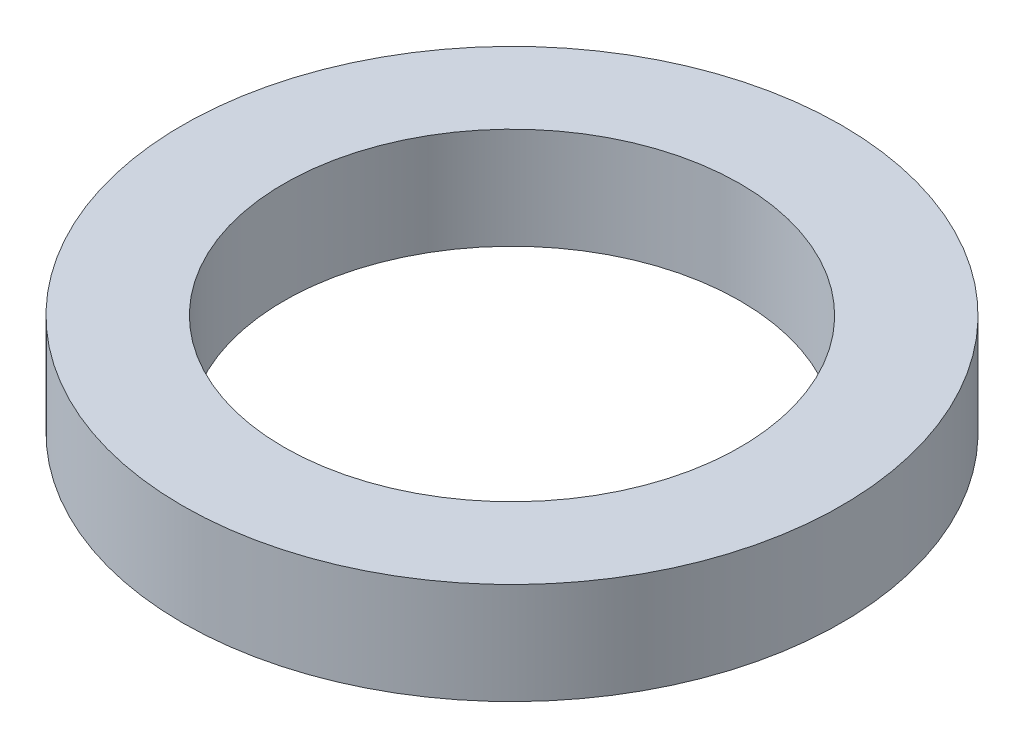
from build123d import *

# Parameters (mm, degrees)
SKETCH1_R           = 32.5
BOSS_EXTRUDE1_DEPTH = 10
SKETCH2_R           = 22.5
CUT_EXTRUDE1_DEPTH  = 48.037219306


with BuildPart() as part:
    # Sketch1 → Boss-Extrude1 (new body)
    with BuildSketch(Plane(origin=(0, 0, 0), x_dir=(1, 0, 0), z_dir=(0, 1, 0))):
        Circle(SKETCH1_R)
    extrude(amount=BOSS_EXTRUDE1_DEPTH)

    # Sketch2 → Cut-Extrude1 (cut, through all)
    with BuildSketch(Plane(origin=(0, 0, 0), x_dir=(1, 0, 0), z_dir=(0, 1, 0))):
        Circle(SKETCH2_R)
    extrude(amount=CUT_EXTRUDE1_DEPTH, mode=Mode.SUBTRACT)


solid = part.part
